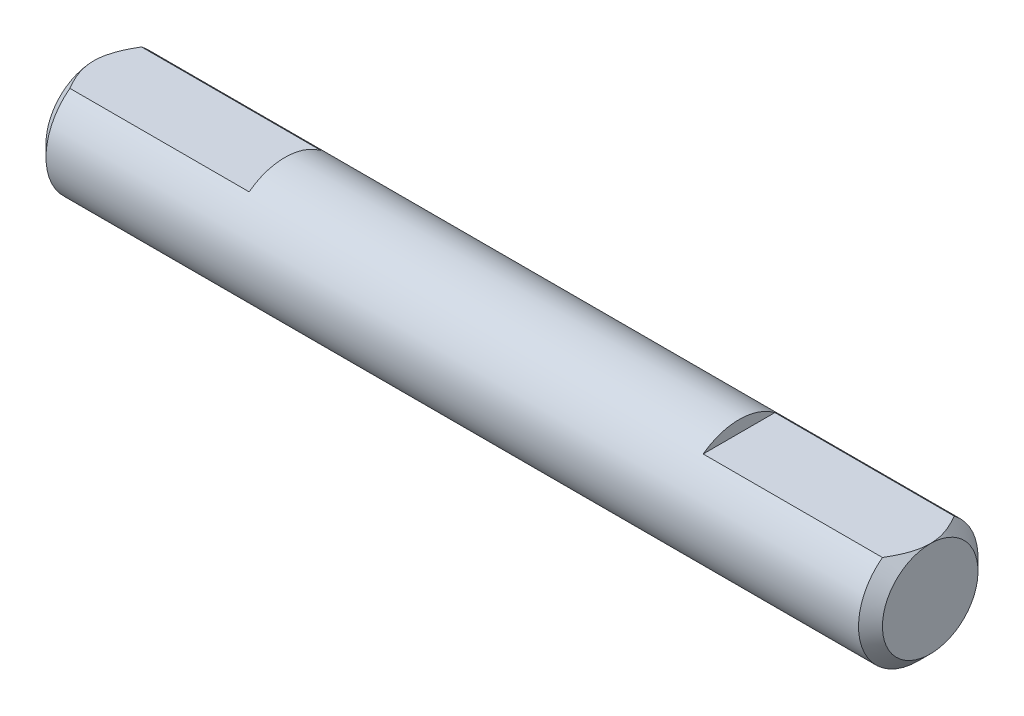
from build123d import *

# Parameters (mm, degrees)
SKETCH1_R           = 2.5
BOSS_EXTRUDE1_DEPTH = 17.5
SKETCH2_W           = 7.702473448
SKETCH2_H           = 1.959232648
CUT_EXTRUDE1_DEPTH  = 28.230497608
CHAMFER4_SIZE       = 0.5
CHAMFER5_SIZE       = 0.5


with BuildPart() as part:
    # Sketch1 → Boss-Extrude1 (new, symmetric)
    with BuildSketch(Plane(origin=(0, 0, 0), x_dir=(0, 0, -1), z_dir=(1, 0, 0))):
        Circle(SKETCH1_R)
    extrude(amount=BOSS_EXTRUDE1_DEPTH, both=True)

    # Sketch2 → Cut-Extrude1 (cut, through all)
    with BuildSketch(Plane(origin=(9.5, 0, 0), x_dir=(0, 0, -1), z_dir=(1, 0, 0))):
        with Locations((0.148863265, 2.979616324)):
            Rectangle(SKETCH2_W, SKETCH2_H)
    cut_extrude1 = extrude(amount=CUT_EXTRUDE1_DEPTH, mode=Mode.SUBTRACT)

    # Mirror1: Cut-Extrude1 across plane
    add(cut_extrude1.mirror(Plane(origin=(0, 0, 0), x_dir=(0, 0, 1), z_dir=(1, 0, 0))), mode=Mode.SUBTRACT)

    # Chamfer4
    chamfer4_edges = [part.edges().sort_by_distance(p)[0] for p in [
        (17.5, -2.236067977, 1.118033989),
    ]]
    chamfer(chamfer4_edges, length=CHAMFER4_SIZE - 0.0001)  # a hair under: the kernel refuses the full size

    # Chamfer5
    chamfer5_edges = [part.edges().sort_by_distance(p)[0] for p in [
        (-17.5, -2.236067977, 1.118033989),
    ]]
    chamfer(chamfer5_edges, length=CHAMFER5_SIZE - 0.0001)  # a hair under: the kernel refuses the full size


solid = part.part
